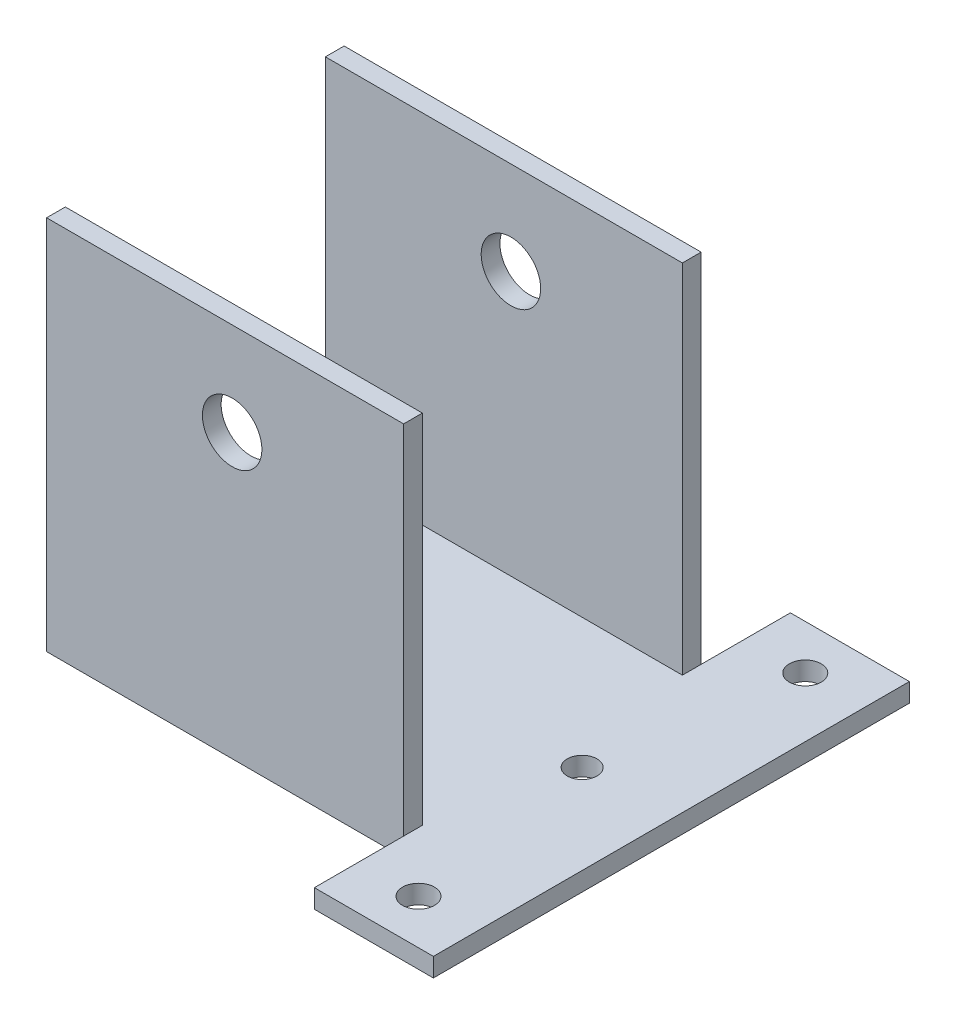
from build123d import *

# Parameters (mm, degrees)
SKETCH1_R           = 1.7
SKETCH1_R_2         = 1.5875
BOSS_EXTRUDE1_DEPTH = 2
SKETCH2_W           = 38.1
SKETCH2_H           = 2
BOSS_EXTRUDE2_DEPTH = 38.1
SKETCH3_R           = 3.175
CUT_EXTRUDE1_DEPTH  = 77.761159612


with BuildPart() as part:
    # Sketch1 → Boss-Extrude1 (new body)
    with BuildSketch(Plane(origin=(0, 0, 0), x_dir=(1, 0, 0), z_dir=(0, 1, 0))):
        Polygon((0, 31.75), (38.1, 31.75), (38.1, 41.275), (50.8, 41.275), (50.8, -9.525), (38.1, -9.525), (38.1, 0), (0, 0), align=None)
        with Locations((44.45, 36.5125)):
            Circle(SKETCH1_R, mode=Mode.SUBTRACT)
        with Locations((44.45, -4.7625)):
            Circle(SKETCH1_R, mode=Mode.SUBTRACT)
        with Locations((9.525, 15.875)):
            Circle(SKETCH1_R_2, mode=Mode.SUBTRACT)
        with Locations((41.275, 15.875)):
            Circle(SKETCH1_R_2, mode=Mode.SUBTRACT)
    extrude(amount=BOSS_EXTRUDE1_DEPTH)

    # Sketch2 → Boss-Extrude2 (add)
    with BuildSketch(Plane(origin=(0, 2, 0), x_dir=(1, 0, 0), z_dir=(0, 1, 0))):
        with Locations((19.05, 30.75)):
            Rectangle(SKETCH2_W, SKETCH2_H)
        with Locations((19.05, 1)):
            Rectangle(SKETCH2_W, SKETCH2_H)
    extrude(amount=BOSS_EXTRUDE2_DEPTH)

    # Sketch3 → Cut-Extrude1 (cut, through all)
    with BuildSketch(Plane.XY):
        with Locations((19.8, 30.16795818)):
            Circle(SKETCH3_R)
    extrude(amount=-CUT_EXTRUDE1_DEPTH, mode=Mode.SUBTRACT)


solid = part.part
